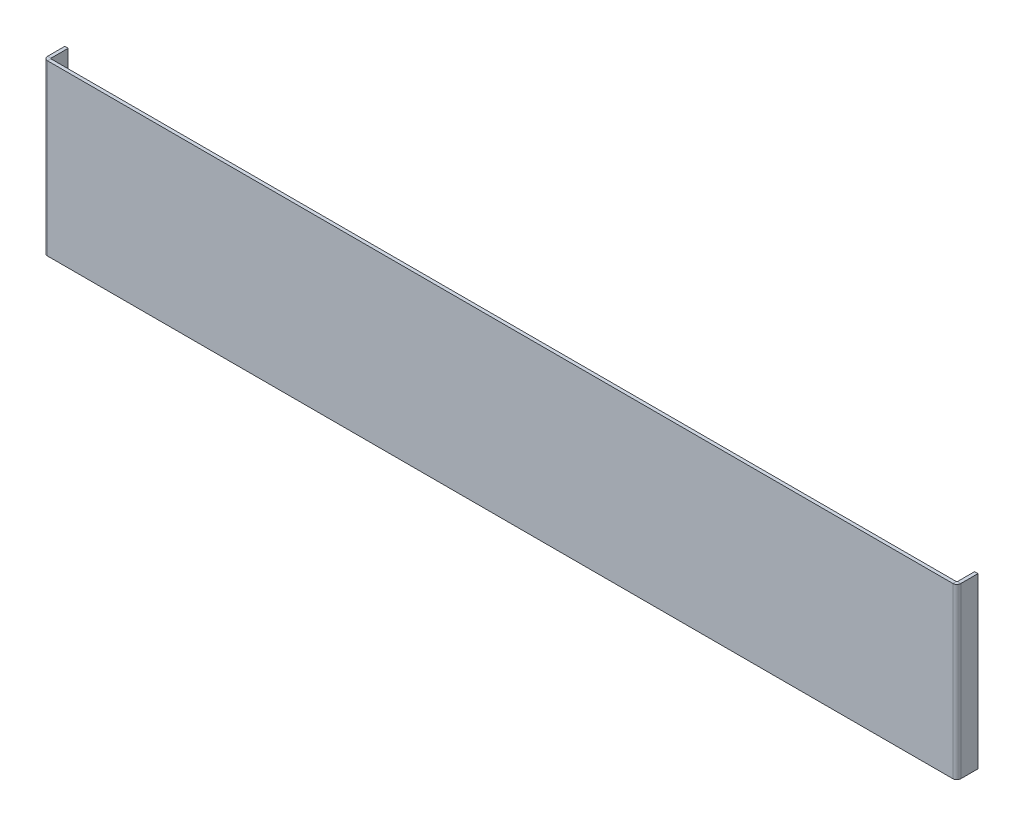
from build123d import *

# Parameters (mm, degrees)
SKETCH_1_W                       = 540
SKETCH_1_H                       = 4
SM_BASE_FLANGE_1_DEPTH           = 100
SM_EDGE_FLANGE_1_STRIP_W         = 17.5
SM_EDGE_FLANGE_1_STRIP_H         = 4
SM_EDGE_FLANGE_1_STRIP_CUT_DEPTH = 100
SM_EDGE_FLANGE_1_DEPTH           = 100


# Sheet-metal steps are written as plain solids
with BuildPart() as part:
    # Sketch 1 → Базовая кромка1 (new body)
    with BuildSketch(Plane(origin=(0, 0, 0), x_dir=(1, 0, 0), z_dir=(0, 1, 0))):
        with Locations((270, -4)):
            Rectangle(SKETCH_1_W, SKETCH_1_H)
    extrude(amount=-SM_BASE_FLANGE_1_DEPTH)

    # Ребро-кромка1 strip (across the edge) → Ребро-кромка1 strip cut (cut)
    with BuildSketch(Plane(origin=(540, 0, 2), x_dir=(-1, 0, 0), z_dir=(0, -1, 0))):
        with Locations((-4, -2)):
            Rectangle(SM_EDGE_FLANGE_1_STRIP_W, SM_EDGE_FLANGE_1_STRIP_H)
    extrude(amount=SM_EDGE_FLANGE_1_STRIP_CUT_DEPTH, mode=Mode.SUBTRACT)

    # Ребро-кромка1 section (across the edge) → Ребро-кромка1 (add)
    with BuildSketch(Plane(origin=(540, 0, 2), x_dir=(-1, 0, 0), z_dir=(0, -1, 0))):
        with BuildLine():
            Line((0, 0.75), (0, 21))
            Line((0, 21), (4, 21))
            Line((4, 21), (4, 0.75))
            ThreePointArc((4, 0.75), (4.219669914, 0.219669914), (4.75, 0))
            Line((4.75, 0), (4.75, -4))
            ThreePointArc((4.75, -4), (1.391242789, -2.608757211), (0, 0.75))
        make_face()
    extrude(amount=SM_EDGE_FLANGE_1_DEPTH)

    # Зеркальное отражение1: part across plane


with BuildPart() as part_1:
    add(part.part)
    add(part.part.mirror(Plane(origin=(0, 0, 0), x_dir=(0, 0, 1), z_dir=(0, -1, 0))))

    # Зеркальное отражение2: part across face


with BuildPart() as part_2:
    add(part_1.part)
    add(part_1.part.mirror(Plane(origin=(0, 0, 4), x_dir=(0, 0, 1), z_dir=(-1, 0, 0))))


solid = part_2.part
